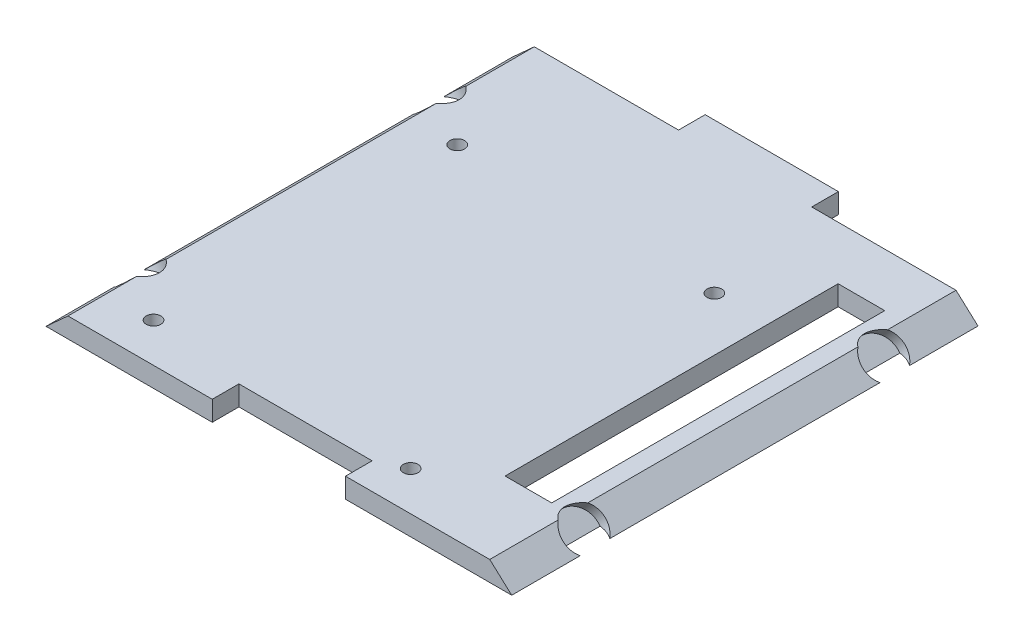
from build123d import *

# Parameters (mm, degrees)
BOSS_EXTRUDE1_DEPTH = 88.9
SKETCH2_R           = 1.397
CUT_EXTRUDE1_DEPTH  = 100.443456884
SKETCH3_W           = 25.4
SKETCH3_H           = 5.08
CUT_EXTRUDE2_DEPTH  = 100.443456884
SKETCH5_W           = 25.4
SKETCH5_H           = 10.16
BOSS_EXTRUDE3_DEPTH = 3.81
SKETCH6_W           = 8.89
SKETCH6_H           = 63.5
CUT_EXTRUDE3_DEPTH  = 100.443456884
SKETCH7_R           = 4
CUT_EXTRUDE4_DEPTH  = 2
SKETCH8_R           = 4
CUT_EXTRUDE5_DEPTH  = 2


with BuildPart() as part:
    # Sketch1 → Boss-Extrude1 (new body)
    with BuildSketch(Plane.XY):
        Polygon((-40.203883769, 5.937788296), (40.203883769, 5.937788296), (44.399042974, 2.127788296), (-44.399042974, 2.127788296), align=None)
    extrude(amount=BOSS_EXTRUDE1_DEPTH)

    # Sketch2 → Cut-Extrude1 (cut, through all)
    with BuildSketch(Plane.XZ.offset(-2.127788296)):
        with Locations((-31.369, 81.429995649)):
            Circle(SKETCH2_R)
        with Locations((17.653, 23.517995649)):
            Circle(SKETCH2_R)
        with Locations((-31.369, 23.517995649)):
            Circle(SKETCH2_R)
        with Locations((17.653, 81.429995649)):
            Circle(SKETCH2_R)
    extrude(amount=-CUT_EXTRUDE1_DEPTH, mode=Mode.SUBTRACT)

    # Sketch3 → Cut-Extrude2 (cut, through all)
    with BuildSketch(Plane.XZ.offset(-2.127788296)):
        with Locations((0, 86.36)):
            Rectangle(SKETCH3_W, SKETCH3_H)
        with Locations((0, 2.54)):
            Rectangle(SKETCH3_W, SKETCH3_H)
    extrude(amount=-CUT_EXTRUDE2_DEPTH, mode=Mode.SUBTRACT)

    # Sketch5 → Boss-Extrude3 (add)
    with BuildSketch(Plane.XZ.offset(-2.127788296)):
        Rectangle(SKETCH5_W, SKETCH5_H)
    extrude(amount=-BOSS_EXTRUDE3_DEPTH)

    # Sketch6 → Cut-Extrude3 (cut, through all)
    with BuildSketch(Plane.XZ.offset(-2.127788296)):
        with Locations((32.334042974, 41.91)):
            Rectangle(SKETCH6_W, SKETCH6_H)
    extrude(amount=-CUT_EXTRUDE3_DEPTH, mode=Mode.SUBTRACT)

    # Sketch7 → Cut-Extrude4 (cut)
    with BuildSketch(Plane(origin=(21.127225221, 23.263011377, 0), x_dir=(0.7402720771062566, -0.6723074087475077, 0), z_dir=(0.6723074087475077, 0.7402720771062566, 0))):
        with Locations((28.603318705, -73.025)):
            Circle(SKETCH7_R)
        with Locations((28.603318705, -15.875)):
            Circle(SKETCH7_R)
    extrude(amount=-CUT_EXTRUDE4_DEPTH, mode=Mode.SUBTRACT)

    # Sketch8 → Cut-Extrude5 (cut)
    with BuildSketch(Plane(origin=(-21.127225221, 23.263011377, 0), x_dir=(0.7402720771062566, 0.6723074087475077, 0), z_dir=(-0.6723074087475077, 0.7402720771062566, 0))):
        with Locations((-28.603318705, -15.875)):
            Circle(SKETCH8_R)
        with Locations((-28.603318705, -73.025)):
            Circle(SKETCH8_R)
    extrude(amount=-CUT_EXTRUDE5_DEPTH, mode=Mode.SUBTRACT)


solid = part.part
